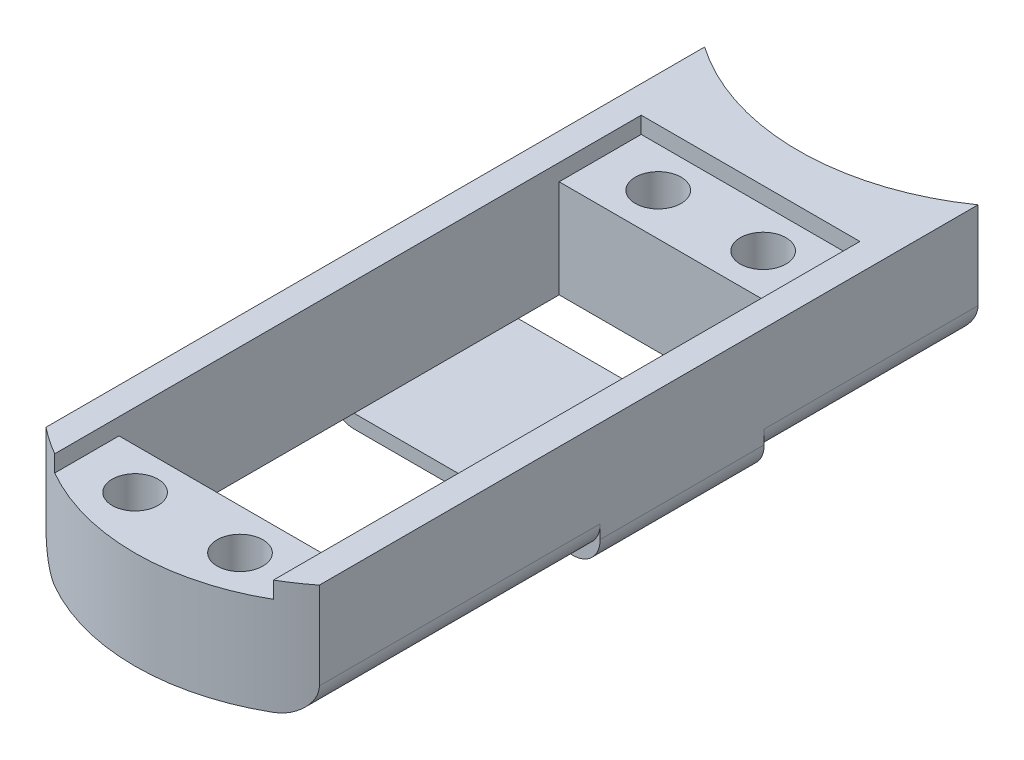
from build123d import *

# Parameters (mm, degrees)
BOSS_EXTRUDE1_DEPTH = 10.65022
SKETCH3_W           = 20.32
SKETCH3_H           = 7.62
CUT_EXTRUDE1_DEPTH  = 1.5494
SKETCH4_R           = 2.12598
CUT_EXTRUDE2_DEPTH  = 19.3294
SKETCH5_R           = 2.12598
BOSS_EXTRUDE2_DEPTH = 9.10082
SKETCH6_W           = 25.4
SKETCH6_H           = 1.27
BOSS_EXTRUDE3_DEPTH = 15.24
FILLET1_R           = 2.54
FILLET2_R           = 2.54


with BuildPart() as part:
    # Sketch2 → Boss-Extrude1 (new body)
    with BuildSketch(Plane(origin=(0, 0, 0), x_dir=(1, 0, 0), z_dir=(0, 1, 0))):
        with BuildLine():
            Line((-12.7, 45.261013597), (-12.7, -15.927319066))
            ThreePointArc((-12.7, -15.927319066), (-11.462644476, -16.839752797), (-10.16, -17.656270632))
            Line((-10.16, -17.656270632), (-10.16, 29.21))
            Line((-10.16, 29.21), (10.16, 29.21))
            Line((10.16, 29.21), (10.16, -17.656270632))
            ThreePointArc((10.16, -17.656270632), (11.462644476, -16.839752797), (12.7, -15.927319066))
            Line((12.7, -15.927319066), (12.7, 45.261013597))
            ThreePointArc((12.7, 45.261013597), (0, 41.275), (-12.7, 45.261013597))
        make_face()
    extrude(amount=-BOSS_EXTRUDE1_DEPTH)

    # Sketch3 → Cut-Extrude1 (cut)
    with BuildSketch(Plane(origin=(0, 0, 0), x_dir=(1, 0, 0), z_dir=(0, 1, 0))):
        with Locations((0, 33.02)):
            Rectangle(SKETCH3_W, SKETCH3_H)
    extrude(amount=-CUT_EXTRUDE1_DEPTH, mode=Mode.SUBTRACT)

    # Sketch4 → Cut-Extrude2 (cut)
    with BuildSketch(Plane(origin=(0, -1.5494, 0), x_dir=(1, 0, 0), z_dir=(0, 1, 0))):
        with Locations(Location((-4.87426, 33.12414, 0), (0, 0, 270))):
            Circle(SKETCH4_R)
        with Locations(Location((4.87426, 33.12414, 0), (0, 0, 270))):
            Circle(SKETCH4_R)
    extrude(amount=-CUT_EXTRUDE2_DEPTH, mode=Mode.SUBTRACT)

    # Sketch5 → Boss-Extrude2 (add)
    with BuildSketch(Plane(origin=(0, -1.5494, 0), x_dir=(1, 0, 0), z_dir=(0, 1, 0))):
        with BuildLine():
            Line((10.16, -11.684), (-10.16, -11.684))
            Line((-10.16, -11.684), (-10.16, -17.656270632))
            ThreePointArc((-10.16, -17.656270632), (0, -20.3708), (10.16, -17.656270632))
            Line((10.16, -17.656270632), (10.16, -11.684))
        make_face()
        with Locations(Location((4.87426, -15.47622, 0), (0, 0, 270))):
            Circle(SKETCH5_R, mode=Mode.SUBTRACT)
        with Locations(Location((-4.87426, -15.47622, 0), (0, 0, 270))):
            Circle(SKETCH5_R, mode=Mode.SUBTRACT)
    extrude(amount=-BOSS_EXTRUDE2_DEPTH)

    # Sketch6 → Boss-Extrude3 (add)
    with BuildSketch(Plane.XY.offset(-10.16)):
        with Locations((0, -11.28522)):
            Rectangle(SKETCH6_W, SKETCH6_H)
    extrude(amount=-BOSS_EXTRUDE3_DEPTH)

    # Fillet1
    fillet1_edges = [part.edges().sort_by_distance(p)[0] for p in [
        (12.7, -10.65022, 2.883659533),
        (-12.7, -10.65022, 2.883659533),
        (-12.7, -10.65022, -35.330506799),
        (12.7, -10.65022, -35.330506799),
    ]]
    fillet(fillet1_edges, radius=FILLET1_R - 0.0001)  # a hair under: the kernel refuses the full size

    # Fillet2
    fillet2_edges = [part.edges().sort_by_distance(p)[0] for p in [
        (-12.7, -11.92022, -17.78),
        (12.7, -11.92022, -17.78),
    ]]
    fillet(fillet2_edges, radius=FILLET2_R)


solid = part.part
